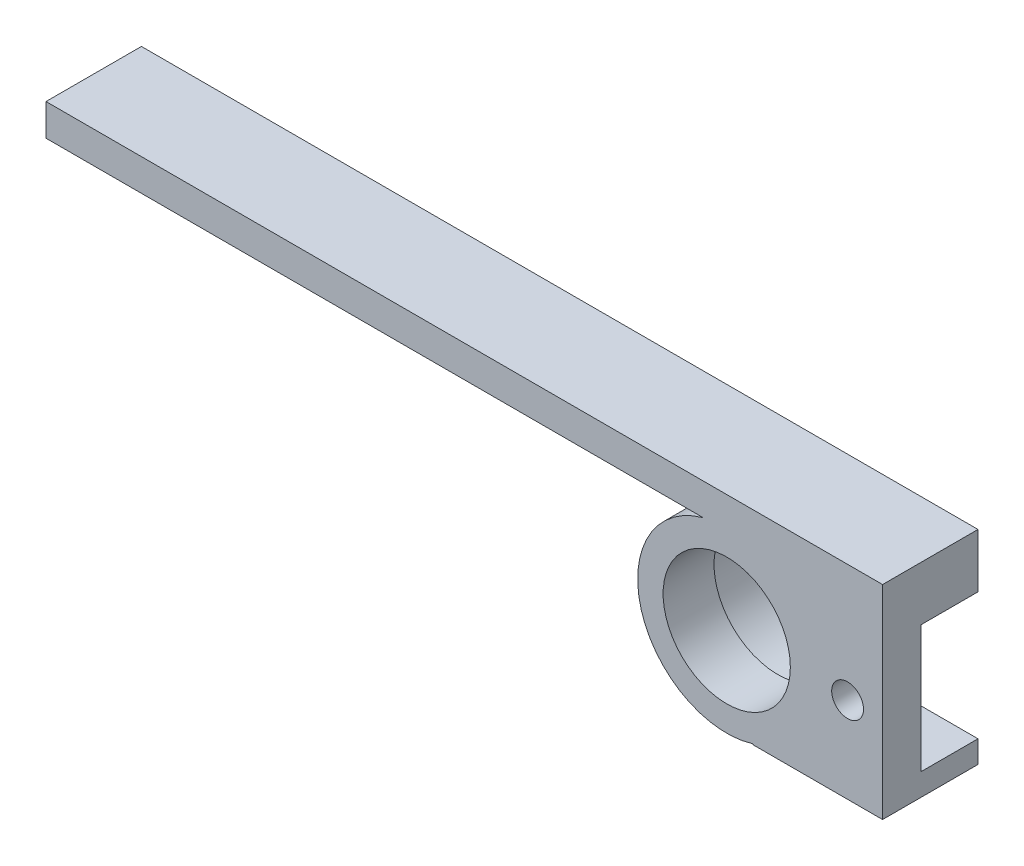
from build123d import *

# Parameters (mm, degrees)
SKETCH_1_W          = 40
SKETCH_1_H          = 20
EXTRUDE_1_DEPTH     = 6
SKETCH_2_R          = 2.5
CUT_EXTRUDE_1_DEPTH = 24.151673806
EXTRUDE_START       = -15
EXTRUDE_2_OUTLINE_R = 11
EXTRUDE_2_DEPTH     = 15
EXTRUDE_START_2     = -8
SKETCH_5_R          = 11
SKETCH_5_R_2        = 10
EXTRUDE_3_DEPTH     = 8
SKETCH_8_W          = 15
SKETCH_8_H          = 5
EXTRUDE_4_DEPTH     = 500
SKETCH_9_W          = 4.037306924
SKETCH_9_H          = 3.364422437
EXTRUDE_5_DEPTH     = 15
SKETCH_10_W         = 26.5
SKETCH_10_H         = 32
CUT_EXTRUDE_2_DEPTH = 481.59052217
SKETCH_12_W         = 363.719511947
SKETCH_12_H         = 27.53578134
CUT_EXTRUDE_3_DEPTH = 482.183177179


# Read off the part's stored shape, not the designer's step: 凸台-拉伸2
with BuildPart() as part:
    # 草图1 → 凸台-拉伸1 (new body)
    with BuildSketch(Plane.XY):
        Rectangle(SKETCH_1_W, SKETCH_1_H)
    extrude(amount=EXTRUDE_1_DEPTH)

    # 草图2 → 切除-拉伸1 (cut, through all)
    with BuildSketch(Plane.XY.offset(6)):
        with Locations((10, 0)):
            Circle(SKETCH_2_R)
        with Locations((-1, 0)):
            Circle(SKETCH_2_R)
        with Locations((-12, 0)):
            Circle(SKETCH_2_R)
    extrude(amount=-CUT_EXTRUDE_1_DEPTH, mode=Mode.SUBTRACT)

    # 凸台-拉伸2 outline → 凸台-拉伸2 (add)
    with BuildSketch(Plane.XY.offset(6).offset(EXTRUDE_START)):
        with BuildLine():
            Line((20, 10), (20, 13.5))
            Line((20, 13.5), (-26.893967141, 13.5))
            Line((-26.893967141, 13.5), (-26.893967141, 13.384337644))
            ThreePointArc((-26.893967141, 13.384337644), (-45, 0), (-26.893967141, -13.384337644))
            Line((-26.893967141, -13.384337644), (-26.893967141, -13.5))
            Line((-26.893967141, -13.5), (20, -13.5))
            Line((20, -13.5), (20, -10))
            Line((20, -10), (-20, -10))
            Line((-20, -10), (-20, -8.660254038))
            ThreePointArc((-20, -8.660254038), (-17, 0), (-20, 8.660254038))
            Line((-20, 8.660254038), (-20, 10))
            Line((-20, 10), (20, 10))
        make_face()
        with Locations((-31, 0)):
            Circle(EXTRUDE_2_OUTLINE_R, mode=Mode.SUBTRACT)
    extrude(amount=EXTRUDE_2_DEPTH)

    # 草图5 → 凸台-拉伸3 (add)
    with BuildSketch(Plane.XY.offset(6).offset(EXTRUDE_START_2)):
        with Locations((-31, 0)):
            Circle(SKETCH_5_R)
        with Locations((-31, 0)):
            Circle(SKETCH_5_R_2, mode=Mode.SUBTRACT)
    extrude(amount=EXTRUDE_3_DEPTH)

    # 草图8 → 凸台-拉伸4 (add)
    with BuildSketch(Plane(origin=(20, 0, 0), x_dir=(0, 0, -1), z_dir=(1, 0, 0))):
        with Locations((1.5, 16)):
            Rectangle(SKETCH_8_W, SKETCH_8_H)
    extrude(amount=-EXTRUDE_4_DEPTH)

    # 草图9 → 凸台-拉伸5 (add, through all)
    with BuildSketch(Plane(origin=(0, 0, -9), x_dir=(-1, 0, 0), z_dir=(0, 0, -1))):
        with Locations((26.475334378, 14.151164675)):
            Rectangle(SKETCH_9_W, SKETCH_9_H)
    extrude(amount=-EXTRUDE_5_DEPTH)

    # 草图10 → 切除-拉伸2 (cut, through all)
    with BuildSketch(Plane.XY.offset(6)):
        with Locations((6.75, 2.5)):
            Rectangle(SKETCH_10_W, SKETCH_10_H)
    extrude(amount=-CUT_EXTRUDE_2_DEPTH, mode=Mode.SUBTRACT)

    # 草图12 → 切除-拉伸3 (cut, through all)
    with BuildSketch(Plane(origin=(0, 18.5, 0), x_dir=(1, 0, 0), z_dir=(0, 1, 0))):
        with Locations((-319.875382276, 7.753964269)):
            Rectangle(SKETCH_12_W, SKETCH_12_H)
    extrude(amount=-CUT_EXTRUDE_3_DEPTH, mode=Mode.SUBTRACT)


solid = part.part
